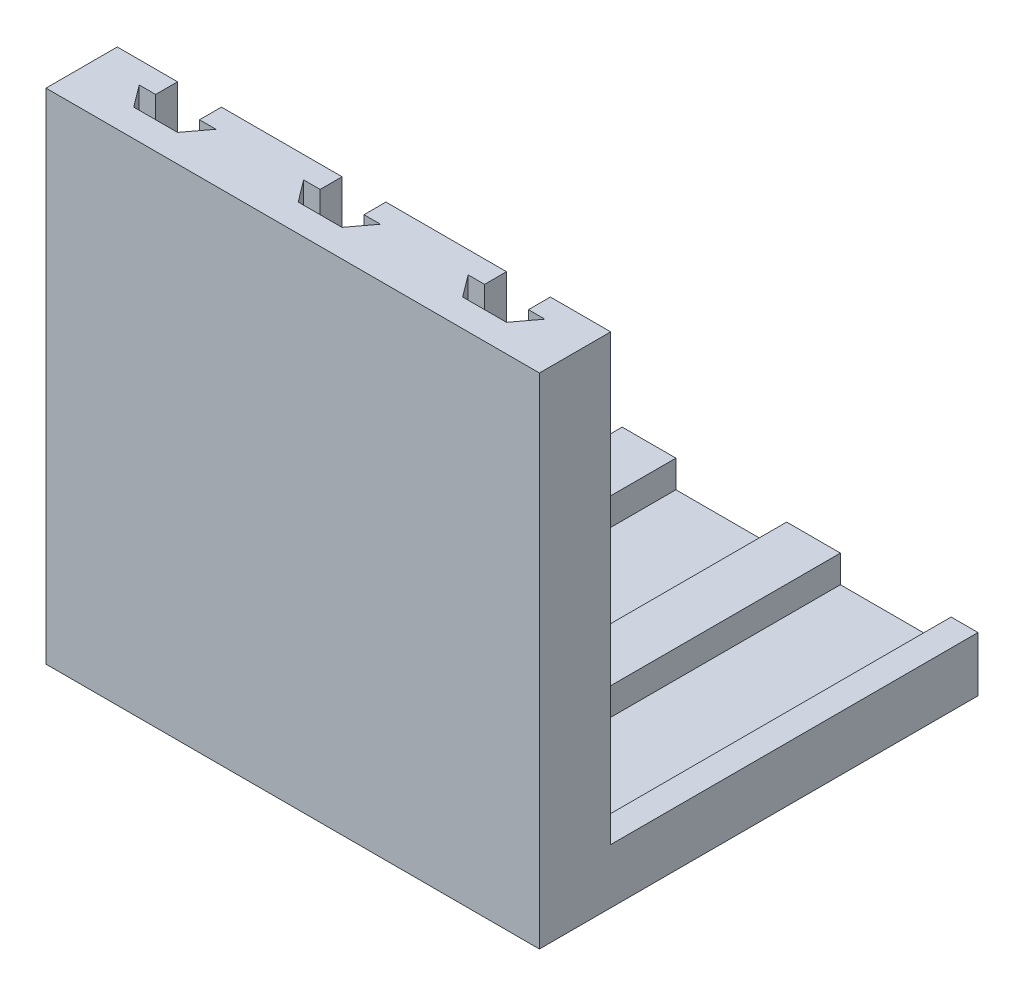
from build123d import *

# Parameters (mm, degrees)
SKETCH1_W           = 30
SKETCH1_H           = 80
BOSS_EXTRUDE1_DEPTH = 10
SKETCH2_W           = 30
SKETCH2_H           = 13
BOSS_EXTRUDE2_DEPTH = 81
CUT_EXTRUDE1_DEPTH  = 40
SKETCH4_W           = 20.2
SKETCH4_H           = 67
CUT_EXTRUDE2_DEPTH  = 5
SKETCH5_W           = 8
SKETCH5_H           = 2
CUT_EXTRUDE3_DEPTH  = 51
LPATTERN1_COUNT     = 3
LPATTERN1_PITCH     = 30


with BuildPart() as part:
    # Sketch1 → Boss-Extrude1 (new body)
    with BuildSketch(Plane(origin=(0, 0, 0), x_dir=(1, 0, 0), z_dir=(0, 1, 0))):
        Rectangle(SKETCH1_W, SKETCH1_H)
    boss_extrude1 = extrude(amount=BOSS_EXTRUDE1_DEPTH)

    # Sketch2 → Boss-Extrude2 (add)
    with BuildSketch(Plane(origin=(0, 10, 0), x_dir=(1, 0, 0), z_dir=(0, 1, 0))):
        with Locations((0, -33.5)):
            Rectangle(SKETCH2_W, SKETCH2_H)
    boss_extrude2 = extrude(amount=BOSS_EXTRUDE2_DEPTH)

    # Sketch3 → Cut-Extrude1 (cut)
    with BuildSketch(Plane(origin=(0, 91, 0), x_dir=(1, 0, 0), z_dir=(0, 1, 0))):
        Polygon((-4, -27), (4, -27), (4, -31), (7, -31), (4, -35), (-4, -35), (-7, -31), (-4, -31), align=None)
    cut_extrude1 = extrude(amount=-CUT_EXTRUDE1_DEPTH, mode=Mode.SUBTRACT)

    # Sketch4 → Cut-Extrude2 (cut)
    with BuildSketch(Plane(origin=(0, 10, 0), x_dir=(1, 0, 0), z_dir=(0, 1, 0))):
        with Locations((0, 6.5)):
            Rectangle(SKETCH4_W, SKETCH4_H)
    cut_extrude2 = extrude(amount=-CUT_EXTRUDE2_DEPTH, mode=Mode.SUBTRACT)

    # Sketch5 → Cut-Extrude3 (cut)
    with BuildSketch(Plane(origin=(0, 51, 0), x_dir=(1, 0, 0), z_dir=(0, 1, 0))):
        with Locations((0, -28)):
            Rectangle(SKETCH5_W, SKETCH5_H)
    cut_extrude3 = extrude(amount=-CUT_EXTRUDE3_DEPTH, mode=Mode.SUBTRACT)

    # LPattern1: Boss-Extrude1, Boss-Extrude2, Cut-Extrude1, Cut-Extrude2, Cut-Extrude3 ×3
    with Locations(*[(-i * LPATTERN1_PITCH, 0, 0) for i in range(1, LPATTERN1_COUNT)]):
        add(boss_extrude1)
        add(boss_extrude2)
        add(cut_extrude1, mode=Mode.SUBTRACT)
        add(cut_extrude2, mode=Mode.SUBTRACT)
        add(cut_extrude3, mode=Mode.SUBTRACT)


solid = part.part
